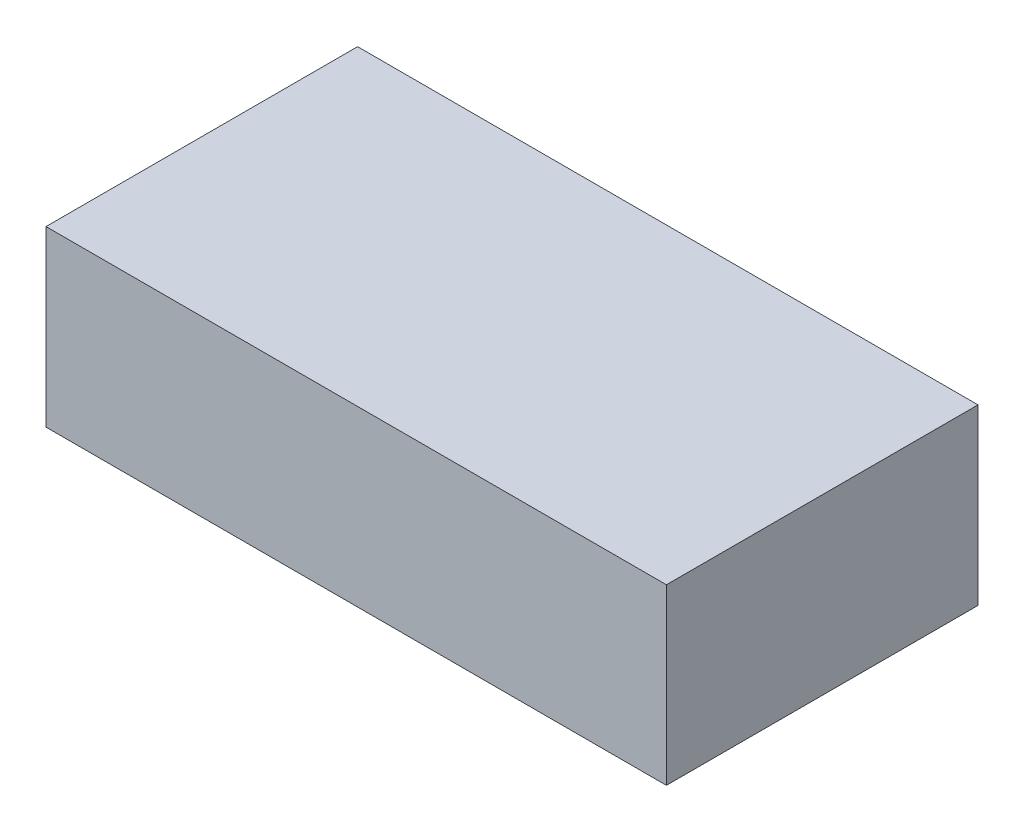
from build123d import *

# Parameters (mm, degrees)
SKETCH_1_W      = 225
SKETCH_1_H      = 113
EXTRUDE_1_DEPTH = 63


with BuildPart() as part:
    # Эскиз1 → Бобышка-Вытянуть1 (new body)
    with BuildSketch(Plane(origin=(0, 0, 0), x_dir=(1, 0, 0), z_dir=(0, 1, 0))):
        Rectangle(SKETCH_1_W, SKETCH_1_H)
    extrude(amount=EXTRUDE_1_DEPTH)


solid = part.part
